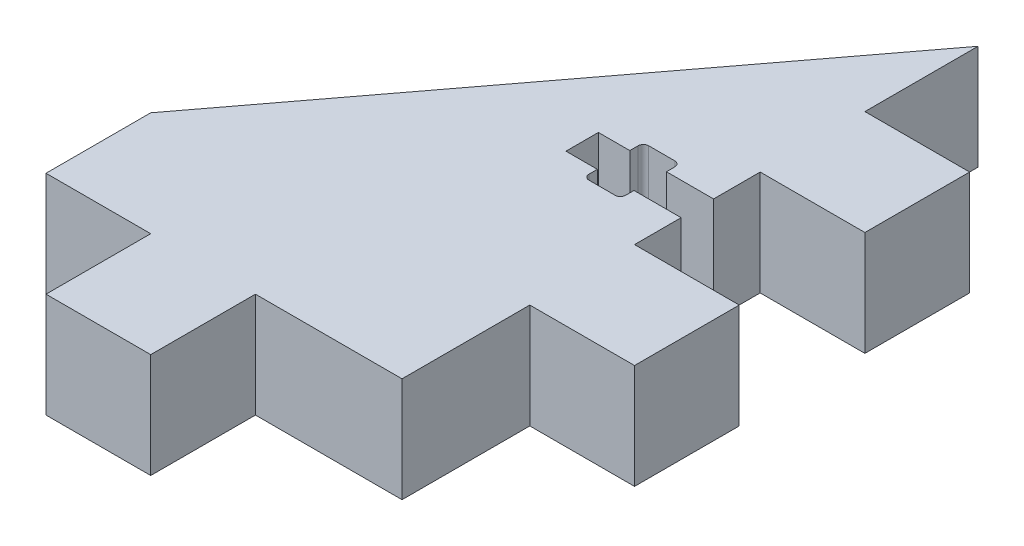
from build123d import *

# Parameters (mm, degrees)
BOSS_EXTRUDE1_DEPTH = 10
CUT_EXTRUDE1_DEPTH  = 66.429351212


with BuildPart() as part:
    # Sketch1 → Boss-Extrude1 (new body)
    with BuildSketch(Plane(origin=(0, 0, 0), x_dir=(1, 0, 0), z_dir=(0, 1, 0))):
        Polygon((0, 0), (-14, 0), (-14, -10), (-24, -10), (-24, 0), (-34, 0), (-34, 10), (0, 55), (0, 44.2), (10, 44.2), (10, 34.2), (0, 34.2), (0, 22.2), (10, 22.2), (10, 12.2), (0, 12.2), align=None)
    extrude(amount=BOSS_EXTRUDE1_DEPTH)

    # Sketch3 → Cut-Extrude1 (cut, through all)
    with BuildSketch(Plane(origin=(0, 10, 0), x_dir=(1, 0, 0), z_dir=(0, 1, 0))):
        with BuildLine():
            Line((-11, 29.75), (-8, 29.75))
            Line((-8, 29.75), (-8, 30.55))
            ThreePointArc((-8, 30.55), (-7.853553391, 30.903553391), (-7.5, 31.05))
            Line((-7.5, 31.05), (-5, 31.05))
            ThreePointArc((-5, 31.05), (-4.646446609, 30.903553391), (-4.5, 30.55))
            Line((-4.5, 30.55), (-4.5, 29.75))
            Line((-4.5, 29.75), (0, 29.75))
            Line((0, 29.75), (0, 26.65))
            Line((0, 26.65), (-4.5, 26.65))
            Line((-4.5, 26.65), (-4.5, 25.85))
            ThreePointArc((-4.5, 25.85), (-4.646446609, 25.496446609), (-5, 25.35))
            Line((-5, 25.35), (-7.5, 25.35))
            ThreePointArc((-7.5, 25.35), (-7.853553391, 25.496446609), (-8, 25.85))
            Line((-8, 25.85), (-8, 26.65))
            Line((-8, 26.65), (-11, 26.65))
            Line((-11, 26.65), (-11, 29.75))
        make_face()
    extrude(amount=-CUT_EXTRUDE1_DEPTH, mode=Mode.SUBTRACT)


solid = part.part
